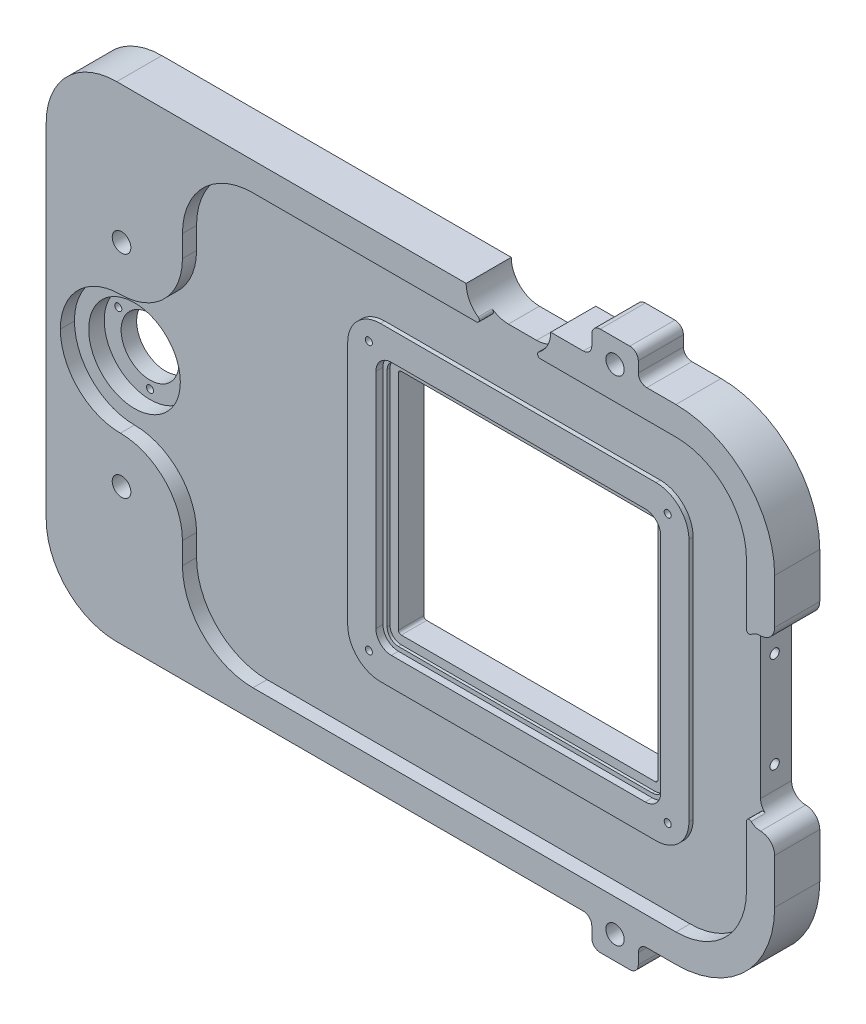
from build123d import *

# Parameters (mm, degrees)
SKETCH1_R                = 16.25
SKETCH1_W                = 121
SKETCH1_H                = 110
BOSS_EXTRUDE1_DEPTH      = 11
SKETCH1_5_W              = 121
SKETCH1_5_H              = 110
SKETCH1_5_W_2            = 101
SKETCH1_5_H_2            = 90
BOSS_EXTRUDE2_DEPTH      = 12.5
SKETCH1_7_W              = 101
SKETCH1_7_H              = 90
SKETCH1_7_W_2            = 98
SKETCH1_7_H_2            = 87
BOSS_EXTRUDE3_DEPTH      = 10
SKETCH1_8_W              = 98
SKETCH1_8_H              = 87
SKETCH1_8_W_2            = 92
SKETCH1_8_H_2            = 81
BOSS_EXTRUDE4_DEPTH      = 9
SKETCH1_9_R              = 16.25
SKETCH1_9_R_2            = 10.25
BOSS_EXTRUDE5_DEPTH      = 5.5
OLES_RUNDING_R           = 11.65
FILLET7_R                = 1
FILLET8_R                = 4
FILLET9_R                = 5.5
M3_TAPPED_HOLE1_D        = 2.5
M4_TAPPED_HOLE2_D        = 3.3
M4_TAPPED_HOLE2_DEPTH    = 10.1
M4_TAPPED_HOLE2_TIP      = 0.991420021
FILLET11_R               = 5
M3_TAPPED_HOLE3_D        = 2.5
M3_TAPPED_HOLE3_DEPTH    = 9.5
M3_TAPPED_HOLE3_TIP      = 0.751075774
BOSS_EXTRUDE6_START      = 5
BOSS_EXTRUDE6_DEPTH      = 5
FILLET12_R               = 25
FILLET13_R               = 22
FILLET14_R               = 21.3
M6_CLEARANCE_HOLE4_D     = 6.6
CUT_EXTRUDE1_DEPTH       = 158.634775668
CUT_EXTRUDE1_DEPTH_BACK  = 158.634775668
FILLET15_START           = 11
FILLET15_DEPTH           = 5
BOSS_EXTRUDE7_DEPTH      = 5
BOSS_EXTRUDE7_DEPTH_BACK = 11
CUT_EXTRUDE2_DEPTH       = 164.158772366
CUT_EXTRUDE2_DEPTH_BACK  = 164.158772366
SKETCH26_3_R             = 3.25
FILLET16_R               = 3
JENS_S_RUNDING_R         = 35


with BuildPart() as part:
    # Sketch1 → Boss-Extrude1 (new body)
    with BuildSketch(Plane.XY):
        Polygon((-121.65, -86), (121.65, -86), (131.65, -86), (131.65, -55), (131.65, -30), (121.65, -30), (121.65, 30), (131.65, 30), (131.65, 55), (131.65, 70), (131.65, 86), (121.65, 86), (-121.65, 86), (-126.65, 86), (-126.65, -86), align=None)
        with Locations((-100.35, 0)):
            Circle(SKETCH1_R, mode=Mode.SUBTRACT)
        with Locations((37.25, 0)):
            Rectangle(SKETCH1_W, SKETCH1_H, mode=Mode.SUBTRACT)
    extrude(amount=BOSS_EXTRUDE1_DEPTH)

    # Sketch1<5> → Boss-Extrude2 (add)
    with BuildSketch(Plane.XY):
        with Locations((37.25, 0)):
            Rectangle(SKETCH1_5_W, SKETCH1_5_H)
        with Locations((37.25, 0)):
            Rectangle(SKETCH1_5_W_2, SKETCH1_5_H_2, mode=Mode.SUBTRACT)
    extrude(amount=BOSS_EXTRUDE2_DEPTH)

    # Sketch1<7> → Boss-Extrude3 (add)
    with BuildSketch(Plane.XY):
        with Locations((37.25, 0)):
            Rectangle(SKETCH1_7_W, SKETCH1_7_H)
        with Locations((37.25, 0)):
            Rectangle(SKETCH1_7_W_2, SKETCH1_7_H_2, mode=Mode.SUBTRACT)
    extrude(amount=BOSS_EXTRUDE3_DEPTH)

    # Sketch1<8> → Boss-Extrude4 (add)
    with BuildSketch(Plane.XY):
        with Locations((37.25, 0)):
            Rectangle(SKETCH1_8_W, SKETCH1_8_H)
        with Locations((37.25, 0)):
            Rectangle(SKETCH1_8_W_2, SKETCH1_8_H_2, mode=Mode.SUBTRACT)
    extrude(amount=BOSS_EXTRUDE4_DEPTH)

    # Sketch1<9> → Boss-Extrude5 (add)
    with BuildSketch(Plane.XY):
        with Locations((-100.35, 0)):
            Circle(SKETCH1_9_R)
        with Locations((-100.35, 0)):
            Circle(SKETCH1_9_R_2, mode=Mode.SUBTRACT)
    extrude(amount=BOSS_EXTRUDE5_DEPTH)

    # oles runding
    oles_runding_edges = [part.edges().sort_by_distance(p)[0] for p in [
        (-23.25, 55, 11.75),
        (-23.25, -55, 11.75),
        (97.75, -55, 11.75),
        (97.75, 55, 11.75),
    ]]
    fillet(oles_runding_edges, radius=OLES_RUNDING_R)

    # Fillet7
    fillet7_edges = [part.edges().sort_by_distance(p)[0] for p in [
        (83.25, -40.5, 4.5),
        (-8.75, -40.5, 4.5),
        (-8.75, 40.5, 4.5),
        (83.25, 40.5, 4.5),
    ]]
    fillet(fillet7_edges, radius=FILLET7_R)

    # Fillet8
    fillet8_edges = [part.edges().sort_by_distance(p)[0] for p in [
        (86.25, -43.5, 9.5),
        (-11.75, -43.5, 9.5),
        (-11.75, 43.5, 9.5),
        (86.25, 43.5, 9.5),
    ]]
    fillet(fillet8_edges, radius=FILLET8_R)

    # Fillet9
    fillet9_edges = [part.edges().sort_by_distance(p)[0] for p in [
        (87.75, -45, 11.25),
        (-13.25, -45, 11.25),
        (-13.25, 45, 11.25),
        (87.75, 45, 11.25),
    ]]
    fillet(fillet9_edges, radius=FILLET9_R)

    # M3 Tapped Hole1 (through all)
    with Locations(Plane.XY.offset(5.5)):
        with Locations((-89.091669751, 6.5), (-100.35, -13), (-111.608330249, 6.5)):
            Hole(M3_TAPPED_HOLE1_D / 2)

    # M4 Tapped Hole2
    with Locations(Plane(origin=(121.65, 0, 0), x_dir=(0, 0, -1), z_dir=(1, 0, 0))):
        with Locations((-6, 17), (-6, -17)):
            Hole(M4_TAPPED_HOLE2_D / 2, depth=M4_TAPPED_HOLE2_DEPTH)
            with Locations((0, 0, -(M4_TAPPED_HOLE2_DEPTH + M4_TAPPED_HOLE2_TIP / 2))):  # 118° drill point
                Cone(0, M4_TAPPED_HOLE2_D / 2, M4_TAPPED_HOLE2_TIP, mode=Mode.SUBTRACT)

    # Fillet11
    fillet11_edges = [part.edges().sort_by_distance(p)[0] for p in [
        (121.65, -30, 5.5),
        (121.65, 30, 5.5),
    ]]
    fillet(fillet11_edges, radius=FILLET11_R)
    fillet11_2_edges = [part.edges().sort_by_distance(p)[0] for p in [
        (131.65, -30, 5.5),
        (131.65, 30, 5.5),
    ]]
    fillet(fillet11_2_edges, radius=FILLET11_R - 0.0001)  # a hair under: the kernel refuses the full size

    # M3 Tapped Hole3
    with Locations(Plane.XY.offset(12.5)):
        with Locations((-15.738440649, -47.488440649), (-15.738440649, 47.488440649), (90.238440649, 47.488440649), (90.238440649, -47.488440649)):
            Hole(M3_TAPPED_HOLE3_D / 2, depth=M3_TAPPED_HOLE3_DEPTH)
            with Locations((0, 0, -(M3_TAPPED_HOLE3_DEPTH + M3_TAPPED_HOLE3_TIP / 2))):  # 118° drill point
                Cone(0, M3_TAPPED_HOLE3_D / 2, M3_TAPPED_HOLE3_TIP, mode=Mode.SUBTRACT)

    # Sketch20 → Boss-Extrude6 (add)
    with BuildSketch(Plane.XY.offset(11).offset(BOSS_EXTRUDE6_START)):
        with BuildLine():
            Line((121.65, -25), (121.65, -76))
            Line((121.65, -76), (-78.35, -76))
            Line((-78.35, -76), (-78.35, -21.3))
            Line((-78.35, -21.3), (-121.65, -21.3))
            Line((-121.65, -21.3), (-121.65, 21.3))
            Line((-121.65, 21.3), (-78.35, 21.3))
            Line((-78.35, 21.3), (-78.35, 76))
            Line((-78.35, 76), (31.535138546, 76))
            Line((31.535138546, 76), (61.535138546, 76))
            Line((61.535138546, 76), (121.65, 76))
            Line((121.65, 76), (121.65, 25))
            ThreePointArc((121.65, 25), (123.114466094, 28.535533906), (126.65, 30))
            ThreePointArc((126.65, 30), (130.185533906, 31.464466094), (131.65, 35))
            Line((131.65, 35), (131.65, 86))
            Line((131.65, 86), (-126.65, 86))
            Line((-126.65, 86), (-126.65, -86))
            Line((-126.65, -86), (131.65, -86))
            Line((131.65, -86), (131.65, -35))
            ThreePointArc((131.65, -35), (130.185533906, -31.464466094), (126.65, -30))
            ThreePointArc((126.65, -30), (123.114466094, -28.535533906), (121.65, -25))
        make_face()
    extrude(amount=-BOSS_EXTRUDE6_DEPTH)

    # Fillet12
    fillet12_edges = [part.edges().sort_by_distance(p)[0] for p in [
        (-126.65, -86, 8),
        (-126.65, 86, 8),
        (121.65, -76, 13.5),
        (-78.35, -76, 13.5),
        (-78.35, 76, 13.5),
        (121.65, 76, 13.5),
    ]]
    fillet(fillet12_edges, radius=FILLET12_R)

    # Fillet13
    fillet13_edges = [part.edges().sort_by_distance(p)[0] for p in [
        (-78.35, -21.3, 13.5),
        (-78.35, 21.3, 13.5),
    ]]
    fillet(fillet13_edges, radius=FILLET13_R)

    # Fillet14
    fillet14_edges = [part.edges().sort_by_distance(p)[0] for p in [
        (-121.65, -21.3, 13.5),
        (-121.65, 21.3, 13.5),
    ]]
    fillet(fillet14_edges, radius=FILLET14_R - 0.0001)  # a hair under: the kernel refuses the full size

    # M6 Clearance Hole4 (through all)
    with Locations(Plane.XY.offset(16)):
        with Locations((-99.95, 37.5), (-99.95, -37.5)):
            Hole(M6_CLEARANCE_HOLE4_D / 2)

    # Sketch25 → Cut-Extrude1 (cut, two sides: drawn at the far end of the back side and taken through both)
    with BuildSketch(Plane.XY.offset(11).offset(-CUT_EXTRUDE1_DEPTH_BACK)):
        with BuildLine():
            Line((52.25, 86), (22.25, 86))
            ThreePointArc((22.25, 86), (25.178932188, 78.928932188), (32.25, 76))
            Line((32.25, 76), (42.25, 76))
            ThreePointArc((42.25, 76), (49.321067812, 78.928932188), (52.25, 86))
        make_face()
    extrude(amount=CUT_EXTRUDE1_DEPTH + CUT_EXTRUDE1_DEPTH_BACK, mode=Mode.SUBTRACT)

    # Fillet15: read off the stored shape, not the designer's step
    # Fillet15 outline → Fillet15 (cut)
    with BuildSketch(Plane.XY.offset(FILLET15_START)):
        with BuildLine():
            Line((121.65, -25), (121.65, -29.472135955))
            ThreePointArc((121.65, -29.472135955), (122.24175171, -28.559265026), (123.316666667, -28.726779962))
            ThreePointArc((123.316666667, -28.726779962), (122.085645354, -27.041241452), (121.65, -25))
        make_face()
        with BuildLine():
            ThreePointArc((123.316666667, 28.726779962), (122.24175171, 28.559265026), (121.65, 29.472135955))
            Line((121.65, 29.472135955), (121.65, 25))
            ThreePointArc((121.65, 25), (122.085645354, 27.041241452), (123.316666667, 28.726779962))
        make_face()
        with BuildLine():
            ThreePointArc((48.57455532, 76), (47.621092731, 76.698488655), (47.999595746, 77.818181818))
            ThreePointArc((47.999595746, 77.818181818), (45.265113446, 76.465374107), (42.25, 76))
            Line((42.25, 76), (48.57455532, 76))
        make_face()
        with BuildLine():
            ThreePointArc((26.500404254, 77.818181818), (26.878907269, 76.698488655), (25.92544468, 76))
            Line((25.92544468, 76), (32.25, 76))
            ThreePointArc((32.25, 76), (29.234886554, 76.465374107), (26.500404254, 77.818181818))
        make_face()
    extrude(amount=FILLET15_DEPTH, mode=Mode.SUBTRACT)

    # Sketch26 → Boss-Extrude7 (add, two sides: drawn at the far end of the back side and taken through both)
    with BuildSketch(Plane.XY.offset(11).offset(-BOSS_EXTRUDE7_DEPTH_BACK)):
        with BuildLine():
            Line((72.166859351, -86), (66.8, -86))
            Line((66.8, -86), (66.8, -95.75))
            Line((66.8, -95.75), (83.3, -95.75))
            Line((83.3, -95.75), (83.3, -86))
            Line((83.3, -86), (77.933140649, -86))
            ThreePointArc((77.933140649, -86), (78.206953207, -86.727894796), (78.3, -87.5))
            ThreePointArc((78.3, -87.5), (74.277894796, -90.656953207), (72.166859351, -86))
        make_face()
        with BuildLine():
            Line((66.8, 95.75), (66.8, 86))
            Line((66.8, 86), (72.166859351, 86))
            ThreePointArc((72.166859351, 86), (74.277894796, 90.656953207), (78.3, 87.5))
            ThreePointArc((78.3, 87.5), (78.206953207, 86.727894796), (77.933140649, 86))
            Line((77.933140649, 86), (83.3, 86))
            Line((83.3, 86), (83.3, 95.75))
            Line((83.3, 95.75), (66.8, 95.75))
        make_face()
    extrude(amount=BOSS_EXTRUDE7_DEPTH + BOSS_EXTRUDE7_DEPTH_BACK)

    # Sketch26<3> → Cut-Extrude2 (cut, two sides: drawn at the far end of the back side and taken through both)
    with BuildSketch(Plane.XY.offset(11).offset(-CUT_EXTRUDE2_DEPTH_BACK)):
        with Locations((75.05, -87.5)):
            Circle(SKETCH26_3_R)
        with Locations((75.05, 87.5)):
            Circle(SKETCH26_3_R)
    extrude(amount=CUT_EXTRUDE2_DEPTH + CUT_EXTRUDE2_DEPTH_BACK, mode=Mode.SUBTRACT)

    # Fillet16
    fillet16_edges = [part.edges().sort_by_distance(p)[0] for p in [
        (83.3, -86, 8),
        (83.3, -95.75, 8),
        (66.8, -95.75, 8),
        (66.8, -86, 8),
        (66.8, 86, 8),
        (66.8, 95.75, 8),
        (83.3, 95.75, 8),
        (83.3, 86, 8),
    ]]
    fillet(fillet16_edges, radius=FILLET16_R)

    # Jens's runding
    jens_s_runding_edges = [part.edges().sort_by_distance(p)[0] for p in [
        (131.65, -86, 8),
        (131.65, 86, 8),
    ]]
    fillet(jens_s_runding_edges, radius=JENS_S_RUNDING_R)


solid = part.part
